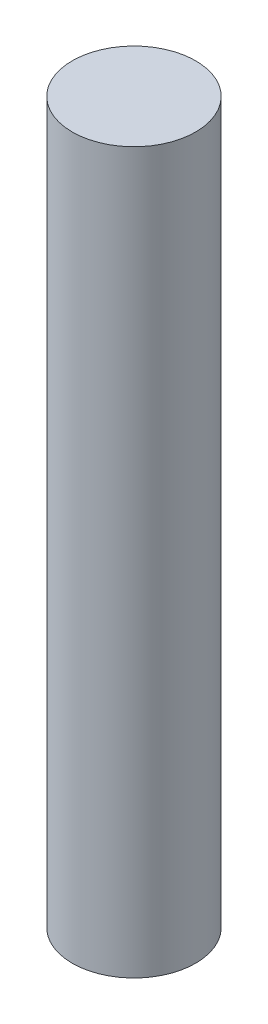
from build123d import *
from build123d.topology import SkipClean

# Parameters (mm, degrees)
SKETCH1_R           = 3
BOSS_EXTRUDE1_DEPTH = 35
CUT_EXTRUDE1_DEPTH  = 22
SKETCH3_R           = 2.5
CUT_EXTRUDE2_DEPTH  = 4


with BuildPart() as part:
    # Sketch1 → Boss-Extrude1 (new body)
    with BuildSketch(Plane(origin=(0, 0, 0), x_dir=(1, 0, 0), z_dir=(0, 1, 0))):
        Circle(SKETCH1_R)
    extrude(amount=BOSS_EXTRUDE1_DEPTH)

    # Sketch2 → Cut-Extrude1 (cut)
    with BuildSketch(Plane.XZ):
        with BuildLine():
            Line((-1.5, 2), (1.5, 2))
            ThreePointArc((1.5, 2), (0, -2.5), (-1.5, 2))
        make_face()
    extrude(amount=-CUT_EXTRUDE1_DEPTH, mode=Mode.SUBTRACT)

    # Sketch3 → Cut-Extrude2 (cut)
    with SkipClean():  # the faces are left unmerged after this step: merging them gives an invalid solid
        with BuildSketch(Plane.XZ):
            Circle(SKETCH3_R)
        extrude(amount=-CUT_EXTRUDE2_DEPTH, mode=Mode.SUBTRACT)


solid = part.part
